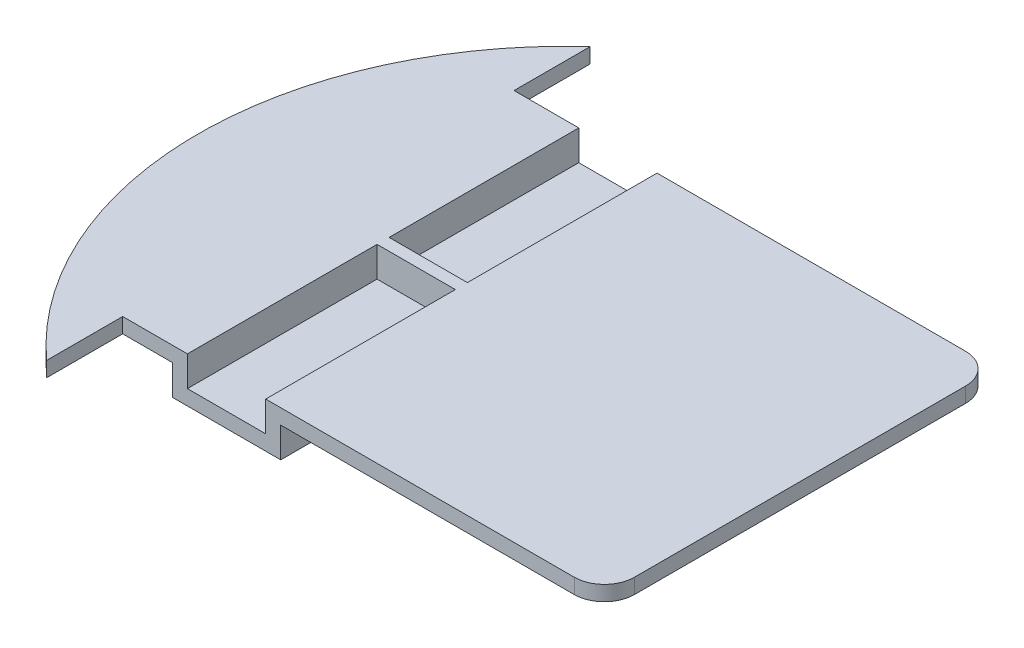
from build123d import *

# Parameters (mm, degrees)
BOSS_EXTRUDE1_DEPTH = 5
FILLET1_R           = 10
SKETCH2_W           = 36
SKETCH2_H           = 15
BOSS_EXTRUDE2_DEPTH = 64
SKETCH4_W           = 26
SKETCH4_H           = 10
CUT_EXTRUDE1_DEPTH  = 63


with BuildPart() as part:
    # Sketch1 → Boss-Extrude1 (new body)
    with BuildSketch(Plane(origin=(0, 0, 0), x_dir=(1, 0, 0), z_dir=(0, 1, 0))):
        with BuildLine():
            Line((40.301843205, 25), (110.301843205, 25))
            Line((110.301843205, 25), (200.301843205, 25))
            Line((200.301843205, 25), (200.301843205, 155))
            Line((200.301843205, 155), (110.301843205, 155))
            Line((110.301843205, 155), (40.301843205, 155))
            Line((40.301843205, 155), (40.301843205, 180.27466017))
            ThreePointArc((40.301843205, 180.27466017), (0.301843205, 90), (40.301843205, -0.27466017))
            Line((40.301843205, -0.27466017), (40.301843205, 25))
        make_face()
    extrude(amount=BOSS_EXTRUDE1_DEPTH)

    # Fillet1
    fillet1_edges = [part.edges().sort_by_distance(p)[0] for p in [
        (200.301843205, 2.5, -155),
        (200.301843205, 2.5, -25),
    ]]
    fillet(fillet1_edges, radius=FILLET1_R)

    # Sketch2 → Boss-Extrude2 (add)
    with BuildSketch(Plane.XY.offset(-25)):
        with Locations((74.801843205, -2.5)):
            Rectangle(SKETCH2_W, SKETCH2_H)
    boss_extrude2 = extrude(amount=-BOSS_EXTRUDE2_DEPTH)

    # Sketch4 → Cut-Extrude1 (cut)
    with BuildSketch(Plane.XY.offset(-25)):
        with Locations((74.801843205, 0)):
            Rectangle(SKETCH4_W, SKETCH4_H)
    cut_extrude1 = extrude(amount=-CUT_EXTRUDE1_DEPTH, mode=Mode.SUBTRACT)

    # Mirror1: Boss-Extrude2, Cut-Extrude1 across plane
    add(boss_extrude2.mirror(Plane.XY.offset(-90)))
    add(cut_extrude1.mirror(Plane.XY.offset(-90)), mode=Mode.SUBTRACT)


solid = part.part
